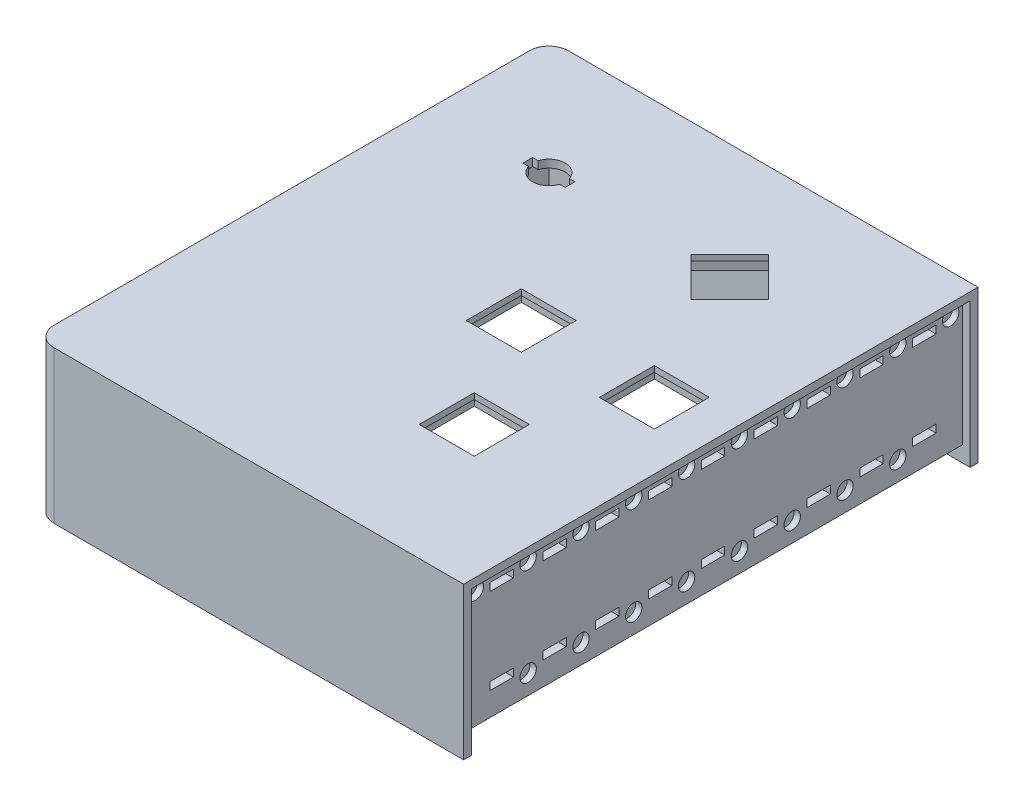
from build123d import *
from build123d.topology import SkipClean

# Parameters (mm, degrees)
SKETCH1_W               = 14.1
SKETCH1_H               = 14.1
BOSS_EXTRUDE1_DEPTH     = 5
SKETCH1_4_W             = 98
SKETCH1_4_H             = 121.85958877
BOSS_EXTRUDE2_DEPTH     = 35
CUT_EXTRUDE1_DEPTH      = 131.041292625
CUT_EXTRUDE1_DEPTH_BACK = 3.5
SKETCH2_W               = 18.1
SKETCH2_H               = 18.1
SKETCH4_W               = 20
SKETCH4_H               = 20
CUT_EXTRUDE2_DEPTH      = 3
BOSS_EXTRUDE3_START     = -4
BOSS_EXTRUDE3_DEPTH     = 4
CUT_EXTRUDE3_DEPTH      = 1.6
SKETCH6_R               = 2.1
CUT_EXTRUDE4_DEPTH      = 1.6
LPATTERN1_COUNT         = 10
LPATTERN1_PITCH         = 13.539954308
LPATTERN1_COUNT_DIR2    = 2
LPATTERN1_PITCH_DIR2    = 25
SKETCH7_W               = 6
SKETCH7_H               = 2
CUT_EXTRUDE5_DEPTH      = 5
LPATTERN2_COUNT         = 9
LPATTERN2_PITCH         = 13.539954308
LPATTERN2_COUNT_DIR2    = 2
LPATTERN2_PITCH_DIR2    = 22
BOSS_EXTRUDE5_DEPTH     = 4
BOSS_EXTRUDE7_DEPTH     = 2
BOSS_EXTRUDE11_START    = 3
BOSS_EXTRUDE11_DEPTH    = 3
CHAMFER1_SIZE           = 4.9999


with BuildPart() as part:
    # Sketch1 → Boss-Extrude1 (new body)
    with BuildSketch(Plane(origin=(0, 0, 0), x_dir=(1, 0, 0), z_dir=(0, 1, 0))):
        with BuildLine():
            ThreePointArc((-108, -60.929794385), (-106.535533906, -64.465328291), (-103, -65.929794385))
            Line((-103, -65.929794385), (0, -65.929794385))
            Line((0, -65.929794385), (0, 65.929794385))
            Line((0, 65.929794385), (-103, 65.929794385))
            ThreePointArc((-103, 65.929794385), (-106.535533906, 64.465328291), (-108, 60.929794385))
            Line((-108, 60.929794385), (-108, -60.929794385))
        make_face()
        Polygon((-32.1, 26.444007948), (-42.070205615, 36.414213562), (-32.1, 46.384419177), (-22.129794385, 36.414213562), align=None, mode=Mode.SUBTRACT)
        with Locations((-32.1, -29.1)):
            Rectangle(SKETCH1_W, SKETCH1_H, mode=Mode.SUBTRACT)
        with Locations((-49.15, 0)):
            Rectangle(SKETCH1_W, SKETCH1_H, mode=Mode.SUBTRACT)
        with Locations((-15.05, 0)):
            Rectangle(SKETCH1_W, SKETCH1_H, mode=Mode.SUBTRACT)
        with BuildLine():
            Line((-82.467900695, 35.164213562), (-83.884419177, 35.164213562))
            Line((-83.884419177, 35.164213562), (-83.884419177, 37.664213562))
            Line((-83.884419177, 37.664213562), (-82.467900695, 37.664213562))
            ThreePointArc((-82.467900695, 37.664213562), (-78.484419177, 40.589213562), (-74.50093766, 37.664213562))
            Line((-74.50093766, 37.664213562), (-73.084419177, 37.664213562))
            Line((-73.084419177, 37.664213562), (-73.084419177, 35.164213562))
            Line((-73.084419177, 35.164213562), (-74.50093766, 35.164213562))
            ThreePointArc((-74.50093766, 35.164213562), (-78.484419177, 32.239213562), (-82.467900695, 35.164213562))
        make_face(mode=Mode.SUBTRACT)
    extrude(amount=-BOSS_EXTRUDE1_DEPTH)

    # Sketch1<4> → Boss-Extrude2 (add)
    with BuildSketch(Plane(origin=(0, 0, 0), x_dir=(1, 0, 0), z_dir=(0, 1, 0))):
        with BuildLine():
            Line((-108, 60.929794385), (-108, -60.929794385))
            ThreePointArc((-108, -60.929794385), (-106.535533906, -64.465328291), (-103, -65.929794385))
            Line((-103, -65.929794385), (0, -65.929794385))
            Line((0, -65.929794385), (0, 65.929794385))
            Line((0, 65.929794385), (-103, 65.929794385))
            ThreePointArc((-103, 65.929794385), (-106.535533906, 64.465328291), (-108, 60.929794385))
        make_face()
        with Locations((-54, 0)):
            Rectangle(SKETCH1_4_W, SKETCH1_4_H, mode=Mode.SUBTRACT)
    extrude(amount=-BOSS_EXTRUDE2_DEPTH)

    # Sketch2 → Cut-Extrude1 (cut, two sides: drawn at the far end of the back side and taken through both)
    with BuildSketch(Plane.XZ.offset(5).offset(-CUT_EXTRUDE1_DEPTH_BACK)):
        with Locations((-32.1, 29.1)):
            Rectangle(SKETCH2_W, SKETCH2_H)
        with Locations((-15.05, 0)):
            Rectangle(SKETCH2_W, SKETCH2_H)
        Polygon((-44.898632739, -36.414213562), (-32.1, -49.212846302), (-19.301367261, -36.414213562), (-32.1, -23.615580823), align=None)
        with Locations((-49.15, 0)):
            Rectangle(SKETCH2_W, SKETCH2_H)
    extrude(amount=CUT_EXTRUDE1_DEPTH + CUT_EXTRUDE1_DEPTH_BACK, mode=Mode.SUBTRACT)

    # Sketch4 → Cut-Extrude2 (cut)
    with BuildSketch(Plane.XZ.offset(5)):
        with Locations((-78.484419177, -36.414213562)):
            Rectangle(SKETCH4_W, SKETCH4_H)
    extrude(amount=-CUT_EXTRUDE2_DEPTH, mode=Mode.SUBTRACT)

    # Sketch5 → Boss-Extrude3 (add)
    with BuildSketch(Plane.XZ.offset(35).offset(BOSS_EXTRUDE3_START)):
        with BuildLine():
            Line((-103, -60.929794385), (-103, -58.829794385))
            ThreePointArc((-103, -58.829794385), (-104.48492424, -62.414718626), (-100.9, -60.929794385))
            Line((-100.9, -60.929794385), (-103, -60.929794385))
        make_face()
        with BuildLine():
            ThreePointArc((-100.9, -60.929794385), (-101.51507576, -59.444870145), (-103, -58.829794385))
            Line((-103, -58.829794385), (-103, -60.929794385))
            Line((-103, -60.929794385), (-100.9, -60.929794385))
        make_face()
        with BuildLine():
            Line((-103, -58.829794385), (-103, -55.929794385))
            ThreePointArc((-103, -55.929794385), (-106.535533906, -64.465328291), (-98, -60.929794385))
            Line((-98, -60.929794385), (-100.9, -60.929794385))
            ThreePointArc((-100.9, -60.929794385), (-104.48492424, -62.414718626), (-103, -58.829794385))
        make_face()
        with BuildLine():
            ThreePointArc((-98, -60.929794385), (-99.464466094, -57.394260479), (-103, -55.929794385))
            Line((-103, -55.929794385), (-103, -58.829794385))
            ThreePointArc((-103, -58.829794385), (-101.51507576, -59.444870145), (-100.9, -60.929794385))
            Line((-100.9, -60.929794385), (-98, -60.929794385))
        make_face()
        with BuildLine():
            Line((-5, -58.829794385), (-5, -55.929794385))
            ThreePointArc((-5, -55.929794385), (-8.535533906, -57.394260479), (-10, -60.929794385))
            Line((-10, -60.929794385), (-7.1, -60.929794385))
            ThreePointArc((-7.1, -60.929794385), (-6.48492424, -59.444870145), (-5, -58.829794385))
        make_face()
        with BuildLine():
            ThreePointArc((0, -60.929794385), (-1.464466094, -57.394260479), (-5, -55.929794385))
            Line((-5, -55.929794385), (-5, -58.829794385))
            ThreePointArc((-5, -58.829794385), (-3.51507576, -59.444870145), (-2.9, -60.929794385))
            ThreePointArc((-2.9, -60.929794385), (-5, -63.029794385), (-7.1, -60.929794385))
            Line((-7.1, -60.929794385), (-10, -60.929794385))
            ThreePointArc((-10, -60.929794385), (-5, -65.929794385), (0, -60.929794385))
        make_face()
        with BuildLine():
            Line((-5, -60.929794385), (-5, -58.829794385))
            ThreePointArc((-5, -58.829794385), (-6.48492424, -59.444870145), (-7.1, -60.929794385))
            Line((-7.1, -60.929794385), (-5, -60.929794385))
        make_face()
        with BuildLine():
            ThreePointArc((-2.9, -60.929794385), (-3.51507576, -59.444870145), (-5, -58.829794385))
            Line((-5, -58.829794385), (-5, -60.929794385))
            Line((-5, -60.929794385), (-7.1, -60.929794385))
            ThreePointArc((-7.1, -60.929794385), (-5, -63.029794385), (-2.9, -60.929794385))
        make_face()
        with BuildLine():
            Line((-5, 60.929794385), (-7.1, 60.929794385))
            ThreePointArc((-7.1, 60.929794385), (-6.48492424, 59.444870145), (-5, 58.829794385))
            Line((-5, 58.829794385), (-5, 60.929794385))
        make_face()
        with BuildLine():
            ThreePointArc((-2.9, 60.929794385), (-5, 63.029794385), (-7.1, 60.929794385))
            Line((-7.1, 60.929794385), (-5, 60.929794385))
            Line((-5, 60.929794385), (-5, 58.829794385))
            ThreePointArc((-5, 58.829794385), (-3.51507576, 59.444870145), (-2.9, 60.929794385))
        make_face()
        with BuildLine():
            Line((-7.1, 60.929794385), (-10, 60.929794385))
            ThreePointArc((-10, 60.929794385), (-8.535533906, 57.394260479), (-5, 55.929794385))
            Line((-5, 55.929794385), (-5, 58.829794385))
            ThreePointArc((-5, 58.829794385), (-6.48492424, 59.444870145), (-7.1, 60.929794385))
        make_face()
        with BuildLine():
            ThreePointArc((0, 60.929794385), (-5, 65.929794385), (-10, 60.929794385))
            Line((-10, 60.929794385), (-7.1, 60.929794385))
            ThreePointArc((-7.1, 60.929794385), (-5, 63.029794385), (-2.9, 60.929794385))
            ThreePointArc((-2.9, 60.929794385), (-3.51507576, 59.444870145), (-5, 58.829794385))
            Line((-5, 58.829794385), (-5, 55.929794385))
            ThreePointArc((-5, 55.929794385), (-1.464466094, 57.394260479), (0, 60.929794385))
        make_face()
        with BuildLine():
            Line((-100.9, 60.929794385), (-98, 60.929794385))
            ThreePointArc((-98, 60.929794385), (-106.535533906, 64.465328291), (-103, 55.929794385))
            Line((-103, 55.929794385), (-103, 58.829794385))
            ThreePointArc((-103, 58.829794385), (-104.48492424, 62.414718626), (-100.9, 60.929794385))
        make_face()
        with BuildLine():
            ThreePointArc((-103, 55.929794385), (-99.464466094, 57.394260479), (-98, 60.929794385))
            Line((-98, 60.929794385), (-100.9, 60.929794385))
            ThreePointArc((-100.9, 60.929794385), (-101.51507576, 59.444870145), (-103, 58.829794385))
            Line((-103, 58.829794385), (-103, 55.929794385))
        make_face()
        with BuildLine():
            Line((-103, 60.929794385), (-100.9, 60.929794385))
            ThreePointArc((-100.9, 60.929794385), (-104.48492424, 62.414718626), (-103, 58.829794385))
            Line((-103, 58.829794385), (-103, 60.929794385))
        make_face()
        with BuildLine():
            ThreePointArc((-103, 58.829794385), (-101.51507576, 59.444870145), (-100.9, 60.929794385))
            Line((-100.9, 60.929794385), (-103, 60.929794385))
            Line((-103, 60.929794385), (-103, 58.829794385))
        make_face()
    extrude(amount=BOSS_EXTRUDE3_DEPTH)

    # Sketch5<3> → Cut-Extrude3 (cut)
    with BuildSketch(Plane.XZ.offset(35)):
        with BuildLine():
            Line((-103, 60.929794385), (-100.9, 60.929794385))
            ThreePointArc((-100.9, 60.929794385), (-104.48492424, 62.414718626), (-103, 58.829794385))
            Line((-103, 58.829794385), (-103, 60.929794385))
        make_face()
        with BuildLine():
            ThreePointArc((-103, 58.829794385), (-101.51507576, 59.444870145), (-100.9, 60.929794385))
            Line((-100.9, 60.929794385), (-103, 60.929794385))
            Line((-103, 60.929794385), (-103, 58.829794385))
        make_face()
        with BuildLine():
            Line((-5, 60.929794385), (-7.1, 60.929794385))
            ThreePointArc((-7.1, 60.929794385), (-6.48492424, 59.444870145), (-5, 58.829794385))
            Line((-5, 58.829794385), (-5, 60.929794385))
        make_face()
        with BuildLine():
            ThreePointArc((-2.9, 60.929794385), (-5, 63.029794385), (-7.1, 60.929794385))
            Line((-7.1, 60.929794385), (-5, 60.929794385))
            Line((-5, 60.929794385), (-5, 58.829794385))
            ThreePointArc((-5, 58.829794385), (-3.51507576, 59.444870145), (-2.9, 60.929794385))
        make_face()
        with BuildLine():
            Line((-5, -60.929794385), (-5, -58.829794385))
            ThreePointArc((-5, -58.829794385), (-6.48492424, -59.444870145), (-7.1, -60.929794385))
            Line((-7.1, -60.929794385), (-5, -60.929794385))
        make_face()
        with BuildLine():
            ThreePointArc((-2.9, -60.929794385), (-3.51507576, -59.444870145), (-5, -58.829794385))
            Line((-5, -58.829794385), (-5, -60.929794385))
            Line((-5, -60.929794385), (-7.1, -60.929794385))
            ThreePointArc((-7.1, -60.929794385), (-5, -63.029794385), (-2.9, -60.929794385))
        make_face()
        with BuildLine():
            Line((-103, -60.929794385), (-103, -58.829794385))
            ThreePointArc((-103, -58.829794385), (-104.48492424, -62.414718626), (-100.9, -60.929794385))
            Line((-100.9, -60.929794385), (-103, -60.929794385))
        make_face()
        with BuildLine():
            ThreePointArc((-100.9, -60.929794385), (-101.51507576, -59.444870145), (-103, -58.829794385))
            Line((-103, -58.829794385), (-103, -60.929794385))
            Line((-103, -60.929794385), (-100.9, -60.929794385))
        make_face()
    extrude(amount=-CUT_EXTRUDE3_DEPTH, mode=Mode.SUBTRACT)

    # Sketch6 → Cut-Extrude4 (cut)
    with BuildSketch(Plane(origin=(0, 0, 0), x_dir=(0, 0, -1), z_dir=(1, 0, 0))):
        with Locations((-60.929794385, -5)):
            Circle(SKETCH6_R)
    cut_extrude4 = extrude(amount=-CUT_EXTRUDE4_DEPTH, mode=Mode.SUBTRACT)

    # LPattern1: Cut-Extrude4 10 × 2, 2 skipped
    with Locations(*[(0, -j * LPATTERN1_PITCH_DIR2, -i * LPATTERN1_PITCH) for i in range(LPATTERN1_COUNT) for j in range(LPATTERN1_COUNT_DIR2) if (i, j) not in ((0, 0), (0, 1), (9, 1))]):
        add(cut_extrude4, mode=Mode.SUBTRACT)

    # Sketch7 → Cut-Extrude5 (cut)
    with BuildSketch(Plane(origin=(0, 0, 0), x_dir=(0, 0, -1), z_dir=(1, 0, 0))):
        with Locations((-54.159817231, -6)):
            Rectangle(SKETCH7_W, SKETCH7_H)
    cut_extrude5 = extrude(amount=-CUT_EXTRUDE5_DEPTH, mode=Mode.SUBTRACT)

    # LPattern2: Cut-Extrude5 9 × 2
    with Locations(*[(0, -j * LPATTERN2_PITCH_DIR2, -i * LPATTERN2_PITCH) for i in range(LPATTERN2_COUNT) for j in range(LPATTERN2_COUNT_DIR2) if (i, j) != (0, 0)]):
        add(cut_extrude5, mode=Mode.SUBTRACT)

    # Sketch10 → Boss-Extrude5 (add)
    with BuildSketch(Plane.XZ.offset(35)):
        with BuildLine():
            Line((0, 65.929794385), (-103, 65.929794385))
            ThreePointArc((-103, 65.929794385), (-106.535533906, 64.465328291), (-108, 60.929794385))
            Line((-108, 60.929794385), (-108, -60.929794385))
            ThreePointArc((-108, -60.929794385), (-106.535533906, -64.465328291), (-103, -65.929794385))
            Line((-103, -65.929794385), (0, -65.929794385))
            Line((0, -65.929794385), (0, -63.929794385))
            Line((0, -63.929794385), (-2, -63.929794385))
            Line((-2, -63.929794385), (-103, -63.929794385))
            ThreePointArc((-103, -63.929794385), (-105.121320344, -63.051114729), (-106, -60.929794385))
            Line((-106, -60.929794385), (-106, 60.929794385))
            ThreePointArc((-106, 60.929794385), (-105.121320344, 63.051114729), (-103, 63.929794385))
            Line((-103, 63.929794385), (-2, 63.929794385))
            Line((-2, 63.929794385), (0, 63.929794385))
            Line((0, 63.929794385), (0, 65.929794385))
        make_face()
    extrude(amount=BOSS_EXTRUDE5_DEPTH)

    # Sketch12 → Boss-Extrude7 (add)
    with BuildSketch(Plane(origin=(0, 0, 0), x_dir=(0, 0, -1), z_dir=(1, 0, 0))):
        Polygon((65.929794385, 0), (-65.929794385, 0), (-65.929794385, -39), (-63.929794385, -39), (-63.929794385, -2), (63.929794385, -2), (63.929794385, -39), (65.929794385, -39), align=None)
    extrude(amount=BOSS_EXTRUDE7_DEPTH)

    # Sketch17 → Boss-Extrude11 (add)
    with SkipClean():  # the faces are left unmerged after this step: merging them gives an invalid solid
        with BuildSketch(Plane(origin=(0, -31, 0), x_dir=(1, 0, 0), z_dir=(0, 1, 0)).offset(BOSS_EXTRUDE11_START)):
            with BuildLine():
                Line((-98, 60.929794385), (-103, 60.929794385))
                Line((-103, 60.929794385), (-103, 55.929794385))
                ThreePointArc((-103, 55.929794385), (-99.464466094, 57.394260479), (-98, 60.929794385))
            make_face()
            with BuildLine():
                Line((-5, 60.929794385), (-10, 60.929794385))
                ThreePointArc((-10, 60.929794385), (-8.535533906, 57.394260479), (-5, 55.929794385))
                Line((-5, 55.929794385), (-5, 60.929794385))
            make_face()
            with BuildLine():
                ThreePointArc((-98, -60.929794385), (-99.464466094, -57.394260479), (-103, -55.929794385))
                Line((-103, -55.929794385), (-103, -60.929794385))
                Line((-103, -60.929794385), (-98, -60.929794385))
            make_face()
            with BuildLine():
                Line((-5, -60.929794385), (-5, -55.929794385))
                ThreePointArc((-5, -55.929794385), (-8.535533906, -57.394260479), (-10, -60.929794385))
                Line((-10, -60.929794385), (-5, -60.929794385))
            make_face()
        extrude(amount=-BOSS_EXTRUDE11_DEPTH)

    # Chamfer1
    # the kernel refuses this chamfer: 4.9999 mm, written as the material it takes off along each edge
    with BuildSketch(Plane(origin=(-103, -28, 60.929794385), x_dir=(1, 0, 0), z_dir=(0, 0, 1))) as chamfer1_piece_1:
        Polygon((5 - CHAMFER1_SIZE, 0), (5, -CHAMFER1_SIZE), (5, 0), align=None)
    revolve(axis=Axis((-103, -28, 60.929794385), (0, 1, 0)), revolution_arc=90, mode=Mode.SUBTRACT)
    with BuildSketch(Plane(origin=(-5, -28, 60.929794385), x_dir=(0, 0, -1), z_dir=(1, 0, 0))) as chamfer1_piece_2:
        Polygon((5, -CHAMFER1_SIZE), (5 - CHAMFER1_SIZE, 0), (5, 0), align=None)
    revolve(axis=Axis((-5, -28, 60.929794385), (0, 1, 0)), revolution_arc=90, mode=Mode.SUBTRACT)
    with BuildSketch(Plane(origin=(-5, -28, -60.929794385), x_dir=(-1, 0, 0), z_dir=(0, 0, -1))) as chamfer1_piece_3:
        Polygon((5, -CHAMFER1_SIZE), (5 - CHAMFER1_SIZE, 0), (5, 0), align=None)
    revolve(axis=Axis((-5, -28, -60.929794385), (0, 1, 0)), revolution_arc=90, mode=Mode.SUBTRACT)
    with BuildSketch(Plane(origin=(-103, -28, -60.929794385), x_dir=(0, 0, 1), z_dir=(-1, 0, 0))) as chamfer1_piece_4:
        Polygon((5 - CHAMFER1_SIZE, 0), (5, -CHAMFER1_SIZE), (5, 0), align=None)
    revolve(axis=Axis((-103, -28, -60.929794385), (0, 1, 0)), revolution_arc=90, mode=Mode.SUBTRACT)


solid = part.part
